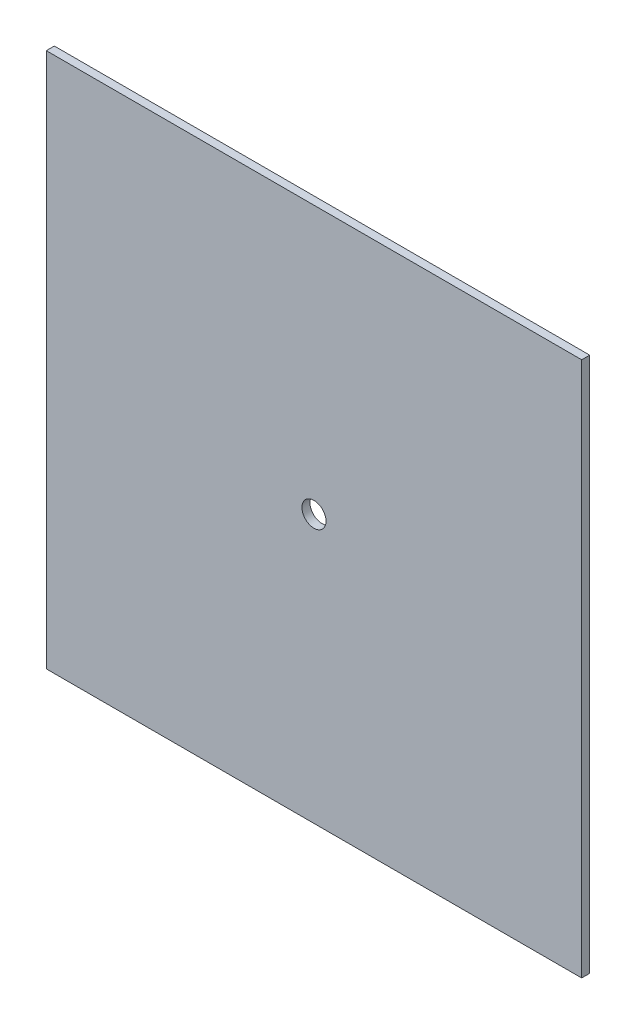
from build123d import *

# Parameters (mm, degrees)
BASEPLATE_W         = 200
BASEPLATE_H         = 200
BOSS_EXTRUDE1_DEPTH = 3
SKETCH3_R           = 4.5
CUT_EXTRUDE1_DEPTH  = 3


with BuildPart() as part:
    # Baseplate → Boss-Extrude1 (new body)
    with BuildSketch(Plane.XY):
        Rectangle(BASEPLATE_W, BASEPLATE_H)
    extrude(amount=BOSS_EXTRUDE1_DEPTH)

    # Sketch3 → Cut-Extrude1 (cut)
    with BuildSketch(Plane.XY.offset(3)):
        Circle(SKETCH3_R)
    extrude(amount=-CUT_EXTRUDE1_DEPTH, mode=Mode.SUBTRACT)


solid = part.part
